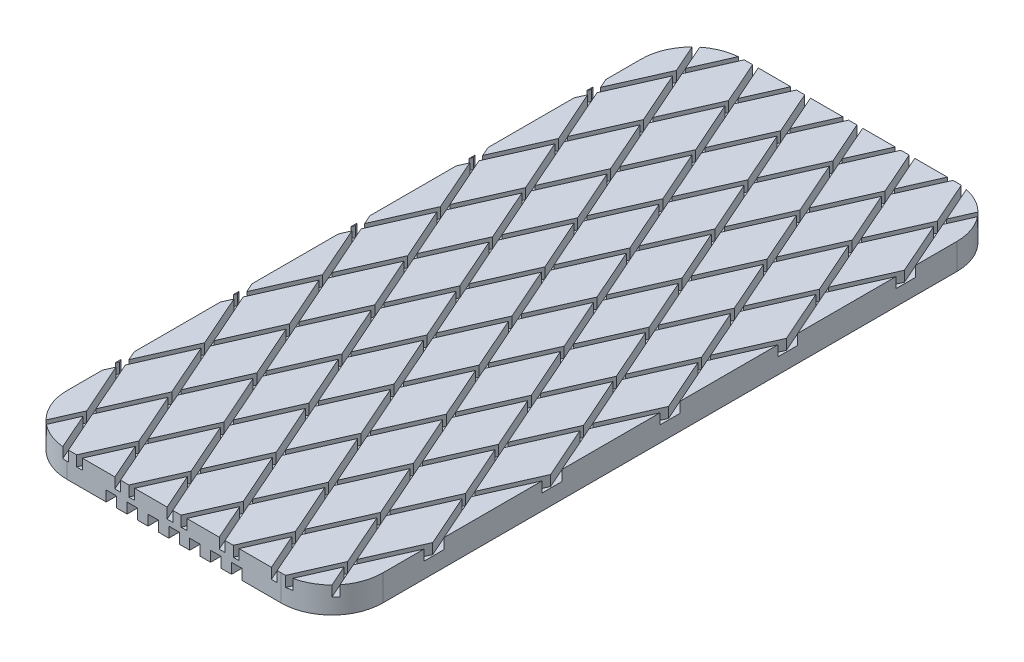
from build123d import *

# Parameters (mm, degrees)
BOSS_EXTRUDE1_DEPTH     = 5
CUT_EXTRUDE_THIN2_DEPTH = 2
SKETCH3_W               = 2
SKETCH3_H               = 129.5
CUT_EXTRUDE_THIN3_DEPTH = 2


with BuildPart() as part:
    # Sketch1 → Boss-Extrude1 (new body)
    with BuildSketch(Plane(origin=(0, 0, 0), x_dir=(1, 0, 0), z_dir=(0, 1, 0))):
        with BuildLine():
            Line((20.5, 64.75), (-20.5, 64.75))
            ThreePointArc((-20.5, 64.75), (-27.394291117, 61.894291117), (-30.25, 55))
            Line((-30.25, 55), (-30.25, -55))
            ThreePointArc((-30.25, -55), (-27.394291117, -61.894291117), (-20.5, -64.75))
            Line((-20.5, -64.75), (20.5, -64.75))
            ThreePointArc((20.5, -64.75), (27.394291117, -61.894291117), (30.25, -55))
            Line((30.25, -55), (30.25, 55))
            ThreePointArc((30.25, 55), (27.394291117, 61.894291117), (20.5, 64.75))
        make_face()
    extrude(amount=BOSS_EXTRUDE1_DEPTH)

    # Sketch2 → Cut-Extrude-Thin2 (cut)
    with BuildSketch(Plane(origin=(0, 5, 0), x_dir=(1, 0, 0), z_dir=(0, 1, 0))):
        Polygon((35.749487401, 80.771908681), (27.394291117, 61.894291117), (-27.394291117, -61.894291117), (-35.565617829, -80.356476255), (-34.651180733, -80.76120431), (-26.479854021, -62.299019171), (28.308728212, 61.489563062), (36.663924496, 80.367180627), align=None)
        Polygon((37.207664059, -84.066493315), (27.394291117, -61.894291117), (-27.394291117, 61.894291117), (-35.454804093, 80.106105198), (-34.540366997, 80.510833252), (-26.479854021, 62.299019171), (28.308728212, -61.489563062), (38.122101155, -83.661765261), align=None)
        Polygon((-25.565617829, -80.356476255), (-17.394291117, -61.894291117), (37.394291117, 61.894291117), (45.749487401, 80.771908681), (46.663924496, 80.367180627), (38.308728212, 61.489563062), (-16.479854021, -62.299019171), (-24.651180733, -80.76120431), align=None)
        Polygon((47.207664059, -84.066493315), (37.394291117, -61.894291117), (-17.394291117, 61.894291117), (-25.454804093, 80.106105198), (-24.540366997, 80.510833252), (-16.479854021, 62.299019171), (38.308728212, -61.489563062), (48.122101155, -83.661765261), align=None)
        Polygon((-15.565617829, -80.356476255), (-7.394291117, -61.894291117), (47.394291117, 61.894291117), (55.749487401, 80.771908681), (56.663924496, 80.367180627), (48.308728212, 61.489563062), (-6.479854021, -62.299019171), (-14.651180733, -80.76120431), align=None)
        Polygon((57.207664059, -84.066493315), (47.394291117, -61.894291117), (-7.394291117, 61.894291117), (-15.454804093, 80.106105198), (-14.540366997, 80.510833252), (-6.479854021, 62.299019171), (48.308728212, -61.489563062), (58.122101155, -83.661765261), align=None)
        Polygon((-5.565617829, -80.356476255), (2.605708883, -61.894291117), (57.394291117, 61.894291117), (65.749487401, 80.771908681), (66.663924496, 80.367180627), (58.308728212, 61.489563062), (3.520145979, -62.299019171), (-4.651180733, -80.76120431), align=None)
        Polygon((67.207664059, -84.066493315), (57.394291117, -61.894291117), (2.605708883, 61.894291117), (-5.454804093, 80.106105198), (-4.540366997, 80.510833252), (3.520145979, 62.299019171), (58.308728212, -61.489563062), (68.122101155, -83.661765261), align=None)
        Polygon((4.434382171, -80.356476255), (12.605708883, -61.894291117), (67.394291117, 61.894291117), (75.749487401, 80.771908681), (76.663924496, 80.367180627), (68.308728212, 61.489563062), (13.520145979, -62.299019171), (5.348819267, -80.76120431), align=None)
        Polygon((77.207664059, -84.066493315), (67.394291117, -61.894291117), (12.605708883, 61.894291117), (4.545195907, 80.106105198), (5.459633003, 80.510833252), (13.520145979, 62.299019171), (68.308728212, -61.489563062), (78.122101155, -83.661765261), align=None)
        Polygon((14.434382171, -80.356476255), (22.605708883, -61.894291117), (77.394291117, 61.894291117), (85.749487401, 80.771908681), (86.663924496, 80.367180627), (78.308728212, 61.489563062), (23.520145979, -62.299019171), (15.348819267, -80.76120431), align=None)
        Polygon((87.207664059, -84.066493315), (77.394291117, -61.894291117), (22.605708883, 61.894291117), (14.545195907, 80.106105198), (15.459633003, 80.510833252), (23.520145979, 62.299019171), (78.308728212, -61.489563062), (88.122101155, -83.661765261), align=None)
        Polygon((-45.565617829, -80.356476255), (-37.394291117, -61.894291117), (17.394291117, 61.894291117), (25.749487401, 80.771908681), (26.663924496, 80.367180627), (18.308728212, 61.489563062), (-36.479854021, -62.299019171), (-44.651180733, -80.76120431), align=None)
        Polygon((27.207664059, -84.066493315), (17.394291117, -61.894291117), (-37.394291117, 61.894291117), (-45.454804093, 80.106105198), (-44.540366997, 80.510833252), (-36.479854021, 62.299019171), (18.308728212, -61.489563062), (28.122101155, -83.661765261), align=None)
        Polygon((-55.565617829, -80.356476255), (-47.394291117, -61.894291117), (7.394291117, 61.894291117), (15.749487401, 80.771908681), (16.663924496, 80.367180627), (8.308728212, 61.489563062), (-46.479854021, -62.299019171), (-54.651180733, -80.76120431), align=None)
        Polygon((17.207664059, -84.066493315), (7.394291117, -61.894291117), (-47.394291117, 61.894291117), (-55.454804093, 80.106105198), (-54.540366997, 80.510833252), (-46.479854021, 62.299019171), (8.308728212, -61.489563062), (18.122101155, -83.661765261), align=None)
        Polygon((-65.565617829, -80.356476255), (-57.394291117, -61.894291117), (-2.605708883, 61.894291117), (5.749487401, 80.771908681), (6.663924496, 80.367180627), (-1.691271788, 61.489563062), (-56.479854021, -62.299019171), (-64.651180733, -80.76120431), align=None)
        Polygon((7.207664059, -84.066493315), (-2.605708883, -61.894291117), (-57.394291117, 61.894291117), (-65.454804093, 80.106105198), (-64.540366997, 80.510833252), (-56.479854021, 62.299019171), (-1.691271788, -61.489563062), (8.122101155, -83.661765261), align=None)
        Polygon((-75.565617829, -80.356476255), (-67.394291117, -61.894291117), (-12.605708883, 61.894291117), (-4.250512599, 80.771908681), (-3.336075504, 80.367180627), (-11.691271788, 61.489563062), (-66.479854021, -62.299019171), (-74.651180733, -80.76120431), align=None)
        Polygon((-2.792335941, -84.066493315), (-12.605708883, -61.894291117), (-67.394291117, 61.894291117), (-75.454804093, 80.106105198), (-74.540366997, 80.510833252), (-66.479854021, 62.299019171), (-11.691271788, -61.489563062), (-1.877898845, -83.661765261), align=None)
        Polygon((-85.565617829, -80.356476255), (-77.394291117, -61.894291117), (-22.605708883, 61.894291117), (-14.250512599, 80.771908681), (-13.336075504, 80.367180627), (-21.691271788, 61.489563062), (-76.479854021, -62.299019171), (-84.651180733, -80.76120431), align=None)
        Polygon((-12.792335941, -84.066493315), (-22.605708883, -61.894291117), (-77.394291117, 61.894291117), (-85.454804093, 80.106105198), (-84.540366997, 80.510833252), (-76.479854021, 62.299019171), (-21.691271788, -61.489563062), (-11.877898845, -83.661765261), align=None)
    extrude(amount=-CUT_EXTRUDE_THIN2_DEPTH, mode=Mode.SUBTRACT)

    # Sketch3 → Cut-Extrude-Thin3 (cut)
    with BuildSketch(Plane(origin=(0, 0, 0), x_dir=(-1, 0, 0), z_dir=(0, -1, 0))):
        Rectangle(SKETCH3_W, SKETCH3_H)
        with Locations((4, 0)):
            Rectangle(SKETCH3_W, SKETCH3_H)
        with Locations((8, 0)):
            Rectangle(SKETCH3_W, SKETCH3_H)
        with Locations((12, 0)):
            Rectangle(SKETCH3_W, SKETCH3_H)
        with Locations((-4, 0)):
            Rectangle(SKETCH3_W, SKETCH3_H)
        with Locations((-8, 0)):
            Rectangle(SKETCH3_W, SKETCH3_H)
        with Locations((-12, 0)):
            Rectangle(SKETCH3_W, SKETCH3_H)
    extrude(amount=-CUT_EXTRUDE_THIN3_DEPTH, mode=Mode.SUBTRACT)


solid = part.part
